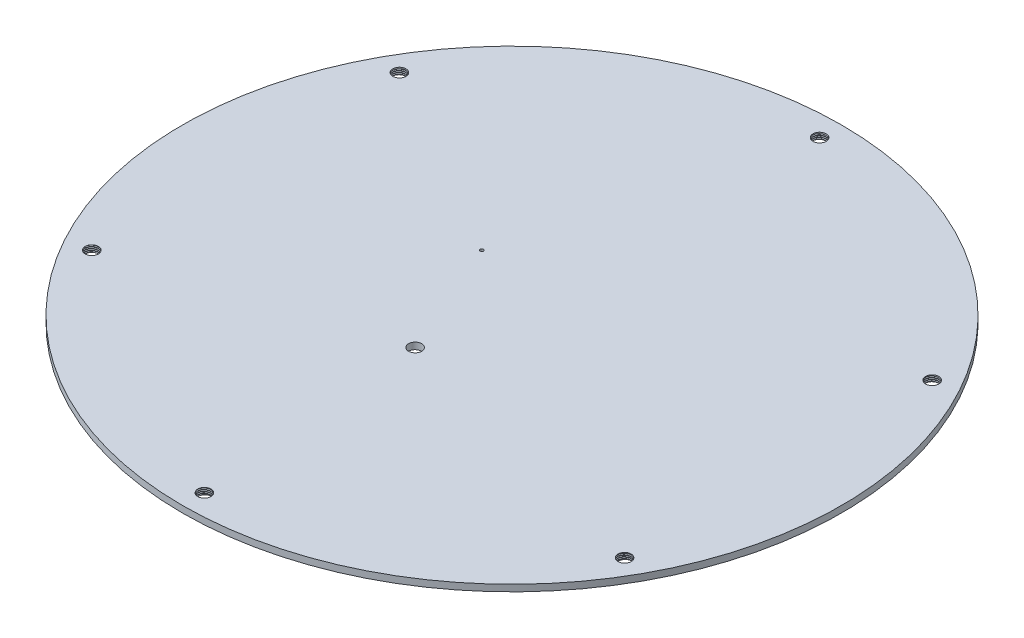
from build123d import *

# Parameters (mm, degrees)
SKETCH1_R               = 50
SKETCH1_R_2             = 1
BOSS_EXTRUDE1_DEPTH     = 1
THREAD1_PITCH           = 0.25
CIRPATTERN1_COUNT       = 6
CUT_EXTRUDE1_DEPTH      = 71.717748976
CUT_EXTRUDE1_DEPTH_BACK = 71.717748976
SKETCH2_R               = 1
SKETCH2_R_2             = 0.25


with BuildPart() as part:
    # Sketch1 → Boss-Extrude1 (new body)
    with BuildSketch(Plane(origin=(0, 0, 0), x_dir=(1, 0, 0), z_dir=(0, 1, 0))):
        with Locations(Location((0, 0, 0), (0, 0, 270))):
            Circle(SKETCH1_R)
        with Locations(Location((0, 46.67, 0), (0, 0, 270))):
            Circle(SKETCH1_R_2, mode=Mode.SUBTRACT)
        with Locations(Location((40.417405595, 23.335, 0), (0, 0, 270))):
            Circle(SKETCH1_R_2, mode=Mode.SUBTRACT)
        with Locations(Location((40.417405595, -23.335, 0), (0, 0, 270))):
            Circle(SKETCH1_R_2, mode=Mode.SUBTRACT)
        with Locations(Location((0, -46.67, 0), (0, 0, 270))):
            Circle(SKETCH1_R_2, mode=Mode.SUBTRACT)
        with Locations(Location((-40.417405595, -23.335, 0), (0, 0, 270))):
            Circle(SKETCH1_R_2, mode=Mode.SUBTRACT)
        with Locations(Location((-40.417405595, 23.335, 0), (0, 0, 270))):
            Circle(SKETCH1_R_2, mode=Mode.SUBTRACT)
    extrude(amount=BOSS_EXTRUDE1_DEPTH)

    # Thread1: arcs per turn and ends read off the stored shape
    # Thread1: the profile of Thread Profile1 profile screwed along a right-hand helix through 40 turns, 6 arcs to a turn; built about Z, then put on its axis
    thread1_z = Axis((0, 0, 0), (0, 0, 1))
    thread1_corners = [(0.9997, 0, -0.000173205), (1.135316468, 0, 0.078125), (1.135316468, 0, 0.109375), (0.9997, 0, 0.187673204)]
    with BuildLine(mode=Mode.PRIVATE) as thread1_profile:
        Line(thread1_corners[0], thread1_corners[1])
        Line(thread1_corners[1], thread1_corners[2])
        Line(thread1_corners[2], thread1_corners[3])
        Line(thread1_corners[3], thread1_corners[0])
    thread1_cap = Face(thread1_profile.wire())
    thread1_turn_angles = [0, 30, 60, 90, 120, 150, 180, 210, 240, 270, 300, 330, 360]
    thread1_turn_weights = [1, 0.8660254037844387, 1, 0.8660254037844387, 1, 0.8660254037844387, 1, 0.8660254037844387, 1, 0.8660254037844387, 1, 0.8660254037844387, 1]
    thread1_turn_rails = [Edge.make_bspline([Vector(p[0], p[1], 0).rotate(thread1_z, thread1_turn_angles[k]) / thread1_turn_weights[k] + Vector(0, 0, p[2] + THREAD1_PITCH * thread1_turn_angles[k] / 360) for k in range(13)], [0, 0, 0, 1, 1, 2, 2, 3, 3, 4, 4, 5, 5, 6, 6, 6], 2, thread1_turn_weights) for p in thread1_corners]
    thread1_turn_sides = [Face.make_surface_from_curves(thread1_turn_rails[p[0]], thread1_turn_rails[p[1]]) for p in [(0, 1), (1, 2), (2, 3), (3, 0)]]
    thread1 = Plane(origin=(-40.417405595, 1, 23.335), x_dir=(-1, 0, 0), z_dir=(0, -1, 0)) * Solid(Shell([*[p.moved(Location((0, 0, THREAD1_PITCH * i))) for i in range(40) for p in thread1_turn_sides], thread1_cap, thread1_cap.rotate(thread1_z, 14400).moved(Location((0, 0, THREAD1_PITCH * 14400 / 360)))]))
    add(thread1, mode=Mode.SUBTRACT)

    # CirPattern1: Thread1 ×6 about axis
    cirpattern1_axis = Axis((0, 0, 0), (0, 1, 0))
    for i in range(1, CIRPATTERN1_COUNT):
        add(thread1.rotate(cirpattern1_axis, i * 360 / CIRPATTERN1_COUNT), mode=Mode.SUBTRACT)

    # Sketch2 → Cut-Extrude1 (cut, two sides: drawn at the far end of the back side and taken through both)
    with BuildSketch(Plane(origin=(0, 1, 0), x_dir=(1, 0, 0), z_dir=(0, 1, 0)).offset(-CUT_EXTRUDE1_DEPTH_BACK)):
        with Locations(Location((-3.105828541, -11.591109915, 0), (0, 0, 270))):
            Circle(SKETCH2_R)
        with Locations(Location((-10.825317547, 6.25, 0), (0, 0, 270))):
            Circle(SKETCH2_R_2)
    extrude(amount=CUT_EXTRUDE1_DEPTH + CUT_EXTRUDE1_DEPTH_BACK, mode=Mode.SUBTRACT)


solid = part.part
